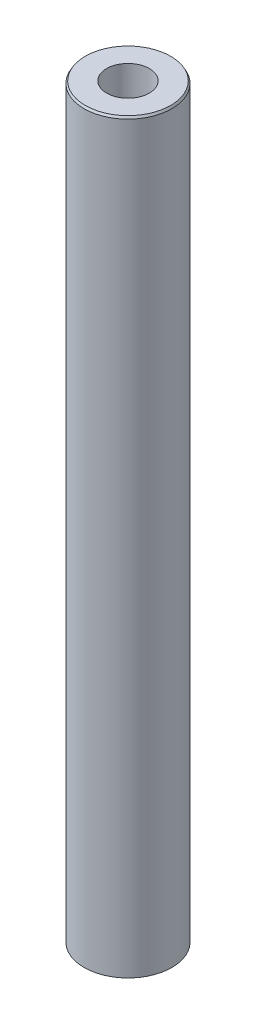
from build123d import *
from OCP.BRepFilletAPI import BRepFilletAPI_MakeChamfer

# Parameters (mm, degrees)
SKETCH1_R           = 12.5
BOSS_EXTRUDE1_DEPTH = 212.698721029
SKETCH2_R           = 6.072971297
CUT_EXTRUDE1_DEPTH  = 214.432063962
CHAMFER1_SIZE       = 0.614866284
CHAMFER1_SIZE2      = 0.354993215


with BuildPart() as part:
    # Sketch1 → Boss-Extrude1 (new body)
    with BuildSketch(Plane(origin=(0, 0, 0), x_dir=(1, 0, 0), z_dir=(0, 1, 0))):
        Circle(SKETCH1_R)
    extrude(amount=BOSS_EXTRUDE1_DEPTH)

    # Sketch2 → Cut-Extrude1 (cut, through all)
    with BuildSketch(Plane(origin=(0, 0, 0), x_dir=(1, 0, 0), z_dir=(0, 1, 0))):
        Circle(SKETCH2_R)
    extrude(amount=CUT_EXTRUDE1_DEPTH, mode=Mode.SUBTRACT)

    # Chamfer1: one chamfer whose edges measure the first distance from different faces: ONE call of the kernel's chamfer builder (chamfer() names one face for all edges)
    chamfer1_edges_1 = [part.edges().sort_by_distance(p)[0] for p in [
        (-12.5, 212.698721029, 0),
    ]]
    chamfer1_side_1 = [part.faces().sort_by_distance(p)[0] for p in [
        (-12.5, 106.349360514, 0),
    ]]
    chamfer1_edges_2 = [part.edges().sort_by_distance(p)[0] for p in [
        (-12.5, 0, 0),
    ]]
    chamfer1_side_2 = [part.faces().sort_by_distance(p)[0] for p in [
        (-12.146446609, 0, 0),
    ]]
    chamfer1 = BRepFilletAPI_MakeChamfer(part.part.solid().wrapped)
    for e in chamfer1_edges_1:
        chamfer1.Add(CHAMFER1_SIZE, CHAMFER1_SIZE2, e.wrapped, chamfer1_side_1[0].wrapped)  # the first distance lies on this face
    for e in chamfer1_edges_2:
        chamfer1.Add(CHAMFER1_SIZE, CHAMFER1_SIZE2, e.wrapped, chamfer1_side_2[0].wrapped)  # the first distance lies on this face
    add(Compound.cast(chamfer1.Shape()), mode=Mode.REPLACE)


solid = part.part
